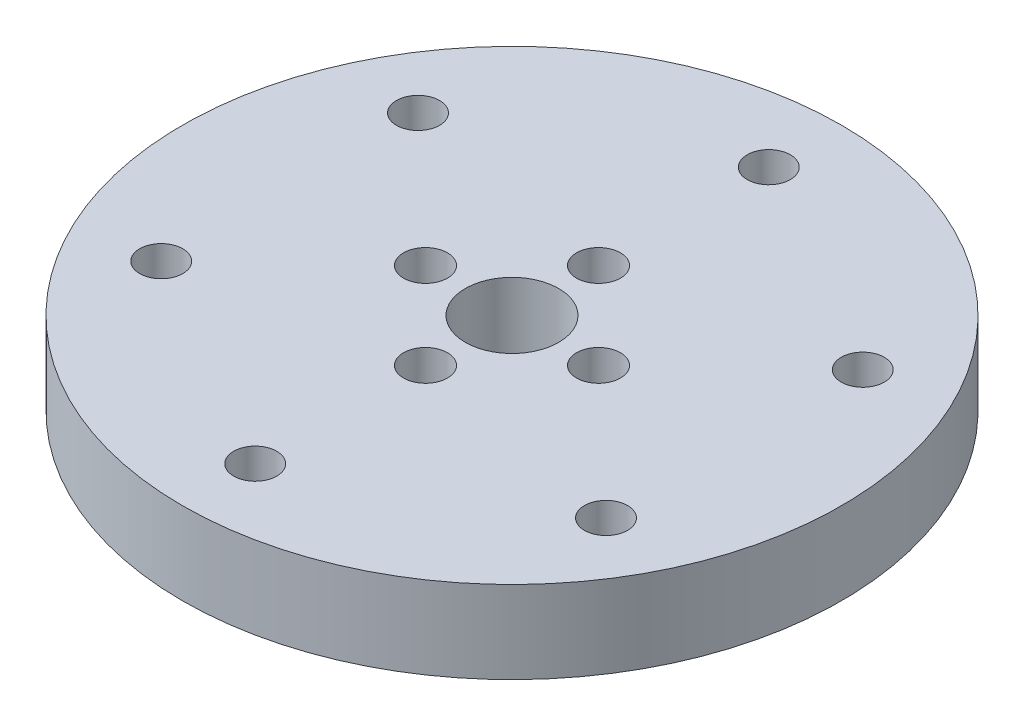
from build123d import *

# Parameters (mm, degrees)
SKETCH1_R           = 30.48
BOSS_EXTRUDE1_DEPTH = 7.62
SKETCH2_R           = 1.9939
CUT_EXTRUDE1_DEPTH  = 44.773567367
CIRPATTERN1_COUNT   = 6
SKETCH3_R           = 4.318
SKETCH3_R_2         = 2.032
CUT_EXTRUDE2_DEPTH  = 44.773567367
CIRPATTERN2_COUNT   = 4


with BuildPart() as part:
    # Sketch1 → Boss-Extrude1 (new body)
    with BuildSketch(Plane(origin=(0, 0, 0), x_dir=(1, 0, 0), z_dir=(0, 1, 0))):
        Circle(SKETCH1_R)
    extrude(amount=BOSS_EXTRUDE1_DEPTH)

    # Sketch2 → Cut-Extrude1 (cut, through all)
    with BuildSketch(Plane(origin=(0, 7.62, 0), x_dir=(1, 0, 0), z_dir=(0, 1, 0))):
        with Locations((0, -23.749)):
            Circle(SKETCH2_R)
    cut_extrude1 = extrude(amount=-CUT_EXTRUDE1_DEPTH, mode=Mode.SUBTRACT)

    # CirPattern1: Cut-Extrude1 ×6 about axis
    cirpattern1_axis = Axis((0, 7.62, 0), (0, -1, 0))
    for i in range(1, CIRPATTERN1_COUNT):
        add(cut_extrude1.rotate(cirpattern1_axis, i * 360 / CIRPATTERN1_COUNT), mode=Mode.SUBTRACT)

    # Sketch3 → Cut-Extrude2 (cut, through all)
    with BuildSketch(Plane(origin=(0, 7.62, 0), x_dir=(1, 0, 0), z_dir=(0, 1, 0))):
        Circle(SKETCH3_R)
        with Locations((0, -8.001)):
            Circle(SKETCH3_R_2)
    cut_extrude2 = extrude(amount=-CUT_EXTRUDE2_DEPTH, mode=Mode.SUBTRACT)

    # CirPattern2: Cut-Extrude2 ×4 about axis
    cirpattern2_axis = Axis((0, 7.62, 0), (0, -1, 0))
    for i in range(1, CIRPATTERN2_COUNT):
        add(cut_extrude2.rotate(cirpattern2_axis, i * 360 / CIRPATTERN2_COUNT), mode=Mode.SUBTRACT)


solid = part.part
